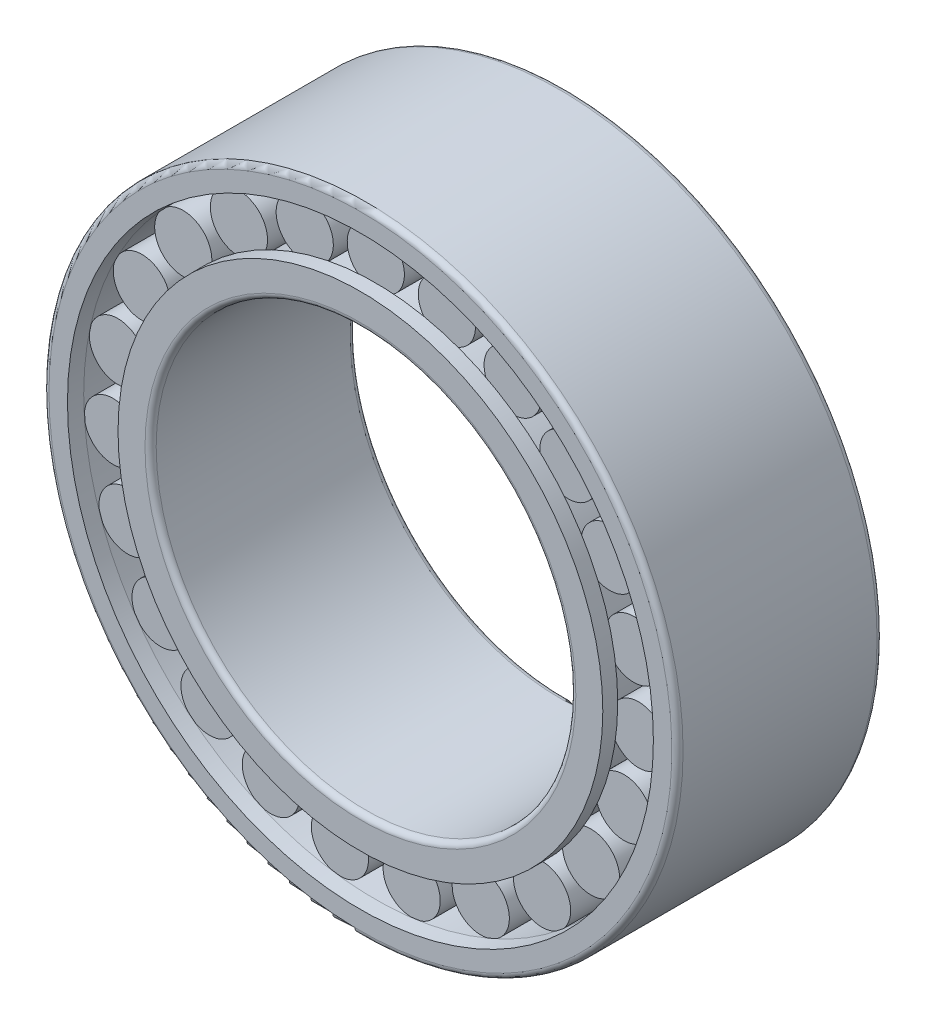
from build123d import *

# Parameters (mm, degrees)
BASESKE_W                       = 7.7
BASESKE_H                       = 3.066666667
FILLET1_R                       = 0.6
CIRPATTERNBALL_COUNT            = 23
CIRPATTERNBALL_COPY_1_SKETCH_W  = 7.7
CIRPATTERNBALL_COPY_1_SKETCH_H  = 3.066666667
CIRPATTERNBALL_COPY_2_SKETCH_W  = 7.7
CIRPATTERNBALL_COPY_2_SKETCH_H  = 3.066666667
CIRPATTERNBALL_COPY_3_SKETCH_W  = 7.7
CIRPATTERNBALL_COPY_3_SKETCH_H  = 3.066666667
CIRPATTERNBALL_COPY_4_SKETCH_W  = 7.7
CIRPATTERNBALL_COPY_4_SKETCH_H  = 3.066666667
CIRPATTERNBALL_COPY_5_SKETCH_W  = 7.7
CIRPATTERNBALL_COPY_5_SKETCH_H  = 3.066666667
CIRPATTERNBALL_COPY_6_SKETCH_W  = 7.7
CIRPATTERNBALL_COPY_6_SKETCH_H  = 3.066666667
CIRPATTERNBALL_COPY_7_SKETCH_W  = 7.7
CIRPATTERNBALL_COPY_7_SKETCH_H  = 3.066666667
CIRPATTERNBALL_COPY_8_SKETCH_W  = 7.7
CIRPATTERNBALL_COPY_8_SKETCH_H  = 3.066666667
CIRPATTERNBALL_COPY_9_SKETCH_W  = 7.7
CIRPATTERNBALL_COPY_9_SKETCH_H  = 3.066666667
CIRPATTERNBALL_COPY_10_SKETCH_W = 7.7
CIRPATTERNBALL_COPY_10_SKETCH_H = 3.066666667
CIRPATTERNBALL_COPY_11_SKETCH_W = 7.7
CIRPATTERNBALL_COPY_11_SKETCH_H = 3.066666667
CIRPATTERNBALL_COPY_12_SKETCH_W = 7.7
CIRPATTERNBALL_COPY_12_SKETCH_H = 3.066666667
CIRPATTERNBALL_COPY_13_SKETCH_W = 7.7
CIRPATTERNBALL_COPY_13_SKETCH_H = 3.066666667
CIRPATTERNBALL_COPY_14_SKETCH_W = 7.7
CIRPATTERNBALL_COPY_14_SKETCH_H = 3.066666667
CIRPATTERNBALL_COPY_15_SKETCH_W = 7.7
CIRPATTERNBALL_COPY_15_SKETCH_H = 3.066666667
CIRPATTERNBALL_COPY_16_SKETCH_W = 7.7
CIRPATTERNBALL_COPY_16_SKETCH_H = 3.066666667
CIRPATTERNBALL_COPY_17_SKETCH_W = 7.7
CIRPATTERNBALL_COPY_17_SKETCH_H = 3.066666667
CIRPATTERNBALL_COPY_18_SKETCH_W = 7.7
CIRPATTERNBALL_COPY_18_SKETCH_H = 3.066666667
CIRPATTERNBALL_COPY_19_SKETCH_W = 7.7
CIRPATTERNBALL_COPY_19_SKETCH_H = 3.066666667
CIRPATTERNBALL_COPY_20_SKETCH_W = 7.7
CIRPATTERNBALL_COPY_20_SKETCH_H = 3.066666667
CIRPATTERNBALL_COPY_21_SKETCH_W = 7.7
CIRPATTERNBALL_COPY_21_SKETCH_H = 3.066666667
CIRPATTERNBALL_COPY_22_SKETCH_W = 7.7
CIRPATTERNBALL_COPY_22_SKETCH_H = 3.066666667


with BuildPart() as part:
    # BaseSke → Roller (revolve)
    with BuildSketch(Plane(origin=(0, 0, 0), x_dir=(0, 0, -1), z_dir=(1, 0, 0))):
        with Locations((-5.5, 26.716666667)):
            Rectangle(BASESKE_W, BASESKE_H)
    roller = revolve(axis=Axis((0, 28.25, 9.35), (0, 0, -1)))

    # OuterRaceSke → OuterRace (revolve)
    with BuildSketch(Plane(origin=(0, 0, 0), x_dir=(0, 0, -1), z_dir=(1, 0, 0))):
        Polygon((-11, 34), (11, 34), (11, 30.508), (9.4, 30.508), (9.4, 31.274666667), (-9.4, 31.274666667), (-9.4, 30.508), (-11, 30.508), align=None)
    revolve(axis=Axis((0, 0, 50.391616343), (0, 0, -1)))

    # Mirror1: Roller across plane
    add(roller.mirror(Plane.XY))

    # InnerRaceSke → InnerRace (revolve)
    with BuildSketch(Plane(origin=(0, 0, 0), x_dir=(0, 0, -1), z_dir=(1, 0, 0))):
        Polygon((-11, 22.5), (11, 22.5), (11, 25.992), (9.4, 25.992), (9.4, 25.225333333), (-9.4, 25.225333333), (-9.4, 25.992), (-11, 25.992), align=None)
    revolve(axis=Axis((0, 0, 70.862590906), (0, 0, -1)))

    # Sketch1 → Cut-Revolve1 (revolve, cut)
    with BuildSketch(Plane(origin=(0, 0, 0), x_dir=(1, 0, 0), z_dir=(0, 1, 0))):
        Polygon((-31.414648528, -11), (-30.508, -11), (-30.508, -9.4), (-31.274666667, -9.4), align=None)
        Polygon((-31.414648528, 11), (-31.274666667, 9.4), (-30.508, 9.4), (-30.508, 11), align=None)
    revolve(axis=Axis((0, 0, 31.329643762), (0, 0, -1)), mode=Mode.SUBTRACT)

    # Fillet1
    fillet1_edges = [part.edges().sort_by_distance(p)[0] for p in [
        (0, -22.5, 11),
        (0, -34, -11),
        (0, -34, 11),
        (0, -22.5, -11),
    ]]
    fillet(fillet1_edges, radius=FILLET1_R)

    # CirPatternBall: Roller ×23 about axis
    cirpatternball_axis = Axis((0, 0, 50.391616343), (0, 0, -1))
    for i in range(1, CIRPATTERNBALL_COUNT):
        add(roller.rotate(cirpatternball_axis, i * 360 / CIRPATTERNBALL_COUNT))

    # CirPatternBall copy 1 sketch → CirPatternBall copy 1 (revolve)
    with BuildSketch(Plane(origin=(0, 0, 0), x_dir=(0, 0, 1), z_dir=(0.9629172873477992, -0.2697967711570243, 0))):
        with Locations((-5.5, -26.716666667)):
            Rectangle(CIRPATTERNBALL_COPY_1_SKETCH_W, CIRPATTERNBALL_COPY_1_SKETCH_H)
    revolve(axis=Axis((7.621758785, 27.202413368, -9.35), (0, 0, -1)))

    # CirPatternBall copy 2 sketch → CirPatternBall copy 2 (revolve)
    with BuildSketch(Plane(origin=(0, 0, 0), x_dir=(0, 0, 1), z_dir=(0.8544194045464886, -0.5195839500354336, 0))):
        with Locations((-5.5, -26.716666667)):
            Rectangle(CIRPATTERNBALL_COPY_2_SKETCH_W, CIRPATTERNBALL_COPY_2_SKETCH_H)
    revolve(axis=Axis((14.678246589, 24.137348178, -9.35), (0, 0, -1)))

    # CirPatternBall copy 3 sketch → CirPatternBall copy 3 (revolve)
    with BuildSketch(Plane(origin=(0, 0, 0), x_dir=(0, 0, 1), z_dir=(0.682553143218654, -0.7308359642781241, 0))):
        with Locations((-5.5, -26.716666667)):
            Rectangle(CIRPATTERNBALL_COPY_3_SKETCH_W, CIRPATTERNBALL_COPY_3_SKETCH_H)
    revolve(axis=Axis((20.646115991, 19.282126296, -9.35), (0, 0, -1)))

    # CirPatternBall copy 4 sketch → CirPatternBall copy 4 (revolve)
    with BuildSketch(Plane(origin=(0, 0, 0), x_dir=(0, 0, 1), z_dir=(0.4600650377311522, -0.8878852184023752, 0))):
        with Locations((-5.5, -26.716666667)):
            Rectangle(CIRPATTERNBALL_COPY_4_SKETCH_W, CIRPATTERNBALL_COPY_4_SKETCH_H)
    revolve(axis=Axis((25.08275742, 12.996837316, -9.35), (0, 0, -1)))

    # CirPatternBall copy 5 sketch → CirPatternBall copy 5 (revolve)
    with BuildSketch(Plane(origin=(0, 0, 0), x_dir=(0, 0, 1), z_dir=(0.20345601305263375, -0.9790840876823229, 0))):
        with Locations((-5.5, -26.716666667)):
            Rectangle(CIRPATTERNBALL_COPY_5_SKETCH_W, CIRPATTERNBALL_COPY_5_SKETCH_H)
    revolve(axis=Axis((27.659125477, 5.747632369, -9.35), (0, 0, -1)))

    # CirPatternBall copy 6 sketch → CirPatternBall copy 6 (revolve)
    with BuildSketch(Plane(origin=(0, 0, 0), x_dir=(0, 0, 1), z_dir=(-0.0682424133646711, -0.9976687691905392, 0))):
        with Locations((-5.5, -26.716666667)):
            Rectangle(CIRPATTERNBALL_COPY_6_SKETCH_W, CIRPATTERNBALL_COPY_6_SKETCH_H)
    revolve(axis=Axis((28.18414273, -1.927848178, -9.35), (0, 0, -1)))

    # CirPatternBall copy 7 sketch → CirPatternBall copy 7 (revolve)
    with BuildSketch(Plane(origin=(0, 0, 0), x_dir=(0, 0, 1), z_dir=(-0.33487961217098616, -0.9422609221188205, 0))):
        with Locations((-5.5, -26.716666667)):
            Rectangle(CIRPATTERNBALL_COPY_7_SKETCH_W, CIRPATTERNBALL_COPY_7_SKETCH_H)
    revolve(axis=Axis((26.61887105, -9.460349044, -9.35), (0, 0, -1)))

    # CirPatternBall copy 8 sketch → CirPatternBall copy 8 (revolve)
    with BuildSketch(Plane(origin=(0, 0, 0), x_dir=(0, 0, 1), z_dir=(-0.5766803221148671, -0.8169698930104421, 0))):
        with Locations((-5.5, -26.716666667)):
            Rectangle(CIRPATTERNBALL_COPY_8_SKETCH_W, CIRPATTERNBALL_COPY_8_SKETCH_H)
    revolve(axis=Axis((23.079399478, -16.2912191, -9.35), (0, 0, -1)))

    # CirPatternBall copy 9 sketch → CirPatternBall copy 9 (revolve)
    with BuildSketch(Plane(origin=(0, 0, 0), x_dir=(0, 0, 1), z_dir=(-0.7757112907044199, -0.6310879443260526, 0))):
        with Locations((-5.5, -26.716666667)):
            Rectangle(CIRPATTERNBALL_COPY_9_SKETCH_W, CIRPATTERNBALL_COPY_9_SKETCH_H)
    revolve(axis=Axis((17.828234427, -21.913843962, -9.35), (0, 0, -1)))

    # CirPatternBall copy 10 sketch → CirPatternBall copy 10 (revolve)
    with BuildSketch(Plane(origin=(0, 0, 0), x_dir=(0, 0, 1), z_dir=(-0.917211301505453, -0.3984010898462414, 0))):
        with Locations((-5.5, -26.716666667)):
            Rectangle(CIRPATTERNBALL_COPY_10_SKETCH_W, CIRPATTERNBALL_COPY_10_SKETCH_H)
    revolve(axis=Axis((11.254830788, -25.911219268, -9.35), (0, 0, -1)))

    # CirPatternBall copy 11 sketch → CirPatternBall copy 11 (revolve)
    with BuildSketch(Plane(origin=(0, 0, 0), x_dir=(0, 0, 1), z_dir=(-0.9906859460363308, -0.13616664909624665, 0))):
        with Locations((-5.5, -26.716666667)):
            Rectangle(CIRPATTERNBALL_COPY_11_SKETCH_W, CIRPATTERNBALL_COPY_11_SKETCH_H)
    revolve(axis=Axis((3.846707837, -27.986877976, -9.35), (0, 0, -1)))

    # CirPatternBall copy 12 sketch → CirPatternBall copy 12 (revolve)
    with BuildSketch(Plane(origin=(0, 0, 0), x_dir=(0, 0, 1), z_dir=(-0.9906859460363308, 0.13616664909624684, 0))):
        with Locations((-5.5, -26.716666667)):
            Rectangle(CIRPATTERNBALL_COPY_12_SKETCH_W, CIRPATTERNBALL_COPY_12_SKETCH_H)
    revolve(axis=Axis((-3.846707837, -27.986877976, -9.35), (0, 0, -1)))

    # CirPatternBall copy 13 sketch → CirPatternBall copy 13 (revolve)
    with BuildSketch(Plane(origin=(0, 0, 0), x_dir=(0, 0, 1), z_dir=(-0.9172113015054529, 0.39840108984624156, 0))):
        with Locations((-5.5, -26.716666667)):
            Rectangle(CIRPATTERNBALL_COPY_13_SKETCH_W, CIRPATTERNBALL_COPY_13_SKETCH_H)
    revolve(axis=Axis((-11.254830788, -25.911219268, -9.35), (0, 0, -1)))

    # CirPatternBall copy 14 sketch → CirPatternBall copy 14 (revolve)
    with BuildSketch(Plane(origin=(0, 0, 0), x_dir=(0, 0, 1), z_dir=(-0.7757112907044198, 0.6310879443260528, 0))):
        with Locations((-5.5, -26.716666667)):
            Rectangle(CIRPATTERNBALL_COPY_14_SKETCH_W, CIRPATTERNBALL_COPY_14_SKETCH_H)
    revolve(axis=Axis((-17.828234427, -21.913843962, -9.35), (0, 0, -1)))

    # CirPatternBall copy 15 sketch → CirPatternBall copy 15 (revolve)
    with BuildSketch(Plane(origin=(0, 0, 0), x_dir=(0, 0, 1), z_dir=(-0.5766803221148672, 0.816969893010442, 0))):
        with Locations((-5.5, -26.716666667)):
            Rectangle(CIRPATTERNBALL_COPY_15_SKETCH_W, CIRPATTERNBALL_COPY_15_SKETCH_H)
    revolve(axis=Axis((-23.079399478, -16.2912191, -9.35), (0, 0, -1)))

    # CirPatternBall copy 16 sketch → CirPatternBall copy 16 (revolve)
    with BuildSketch(Plane(origin=(0, 0, 0), x_dir=(0, 0, 1), z_dir=(-0.3348796121709864, 0.9422609221188204, 0))):
        with Locations((-5.5, -26.716666667)):
            Rectangle(CIRPATTERNBALL_COPY_16_SKETCH_W, CIRPATTERNBALL_COPY_16_SKETCH_H)
    revolve(axis=Axis((-26.61887105, -9.460349044, -9.35), (0, 0, -1)))

    # CirPatternBall copy 17 sketch → CirPatternBall copy 17 (revolve)
    with BuildSketch(Plane(origin=(0, 0, 0), x_dir=(0, 0, 1), z_dir=(-0.06824241336467135, 0.9976687691905392, 0))):
        with Locations((-5.5, -26.716666667)):
            Rectangle(CIRPATTERNBALL_COPY_17_SKETCH_W, CIRPATTERNBALL_COPY_17_SKETCH_H)
    revolve(axis=Axis((-28.18414273, -1.927848178, -9.35), (0, 0, -1)))

    # CirPatternBall copy 18 sketch → CirPatternBall copy 18 (revolve)
    with BuildSketch(Plane(origin=(0, 0, 0), x_dir=(0, 0, 1), z_dir=(0.20345601305263417, 0.9790840876823228, 0))):
        with Locations((-5.5, -26.716666667)):
            Rectangle(CIRPATTERNBALL_COPY_18_SKETCH_W, CIRPATTERNBALL_COPY_18_SKETCH_H)
    revolve(axis=Axis((-27.659125477, 5.747632369, -9.35), (0, 0, -1)))

    # CirPatternBall copy 19 sketch → CirPatternBall copy 19 (revolve)
    with BuildSketch(Plane(origin=(0, 0, 0), x_dir=(0, 0, 1), z_dir=(0.4600650377311516, 0.8878852184023756, 0))):
        with Locations((-5.5, -26.716666667)):
            Rectangle(CIRPATTERNBALL_COPY_19_SKETCH_W, CIRPATTERNBALL_COPY_19_SKETCH_H)
    revolve(axis=Axis((-25.08275742, 12.996837316, -9.35), (0, 0, -1)))

    # CirPatternBall copy 20 sketch → CirPatternBall copy 20 (revolve)
    with BuildSketch(Plane(origin=(0, 0, 0), x_dir=(0, 0, 1), z_dir=(0.6825531432186542, 0.730835964278124, 0))):
        with Locations((-5.5, -26.716666667)):
            Rectangle(CIRPATTERNBALL_COPY_20_SKETCH_W, CIRPATTERNBALL_COPY_20_SKETCH_H)
    revolve(axis=Axis((-20.646115991, 19.282126296, -9.35), (0, 0, -1)))

    # CirPatternBall copy 21 sketch → CirPatternBall copy 21 (revolve)
    with BuildSketch(Plane(origin=(0, 0, 0), x_dir=(0, 0, 1), z_dir=(0.8544194045464886, 0.5195839500354336, 0))):
        with Locations((-5.5, -26.716666667)):
            Rectangle(CIRPATTERNBALL_COPY_21_SKETCH_W, CIRPATTERNBALL_COPY_21_SKETCH_H)
    revolve(axis=Axis((-14.678246589, 24.137348178, -9.35), (0, 0, -1)))

    # CirPatternBall copy 22 sketch → CirPatternBall copy 22 (revolve)
    with BuildSketch(Plane(origin=(0, 0, 0), x_dir=(0, 0, 1), z_dir=(0.9629172873477992, 0.2697967711570244, 0))):
        with Locations((-5.5, -26.716666667)):
            Rectangle(CIRPATTERNBALL_COPY_22_SKETCH_W, CIRPATTERNBALL_COPY_22_SKETCH_H)
    revolve(axis=Axis((-7.621758785, 27.202413368, -9.35), (0, 0, -1)))


solid = part.part
